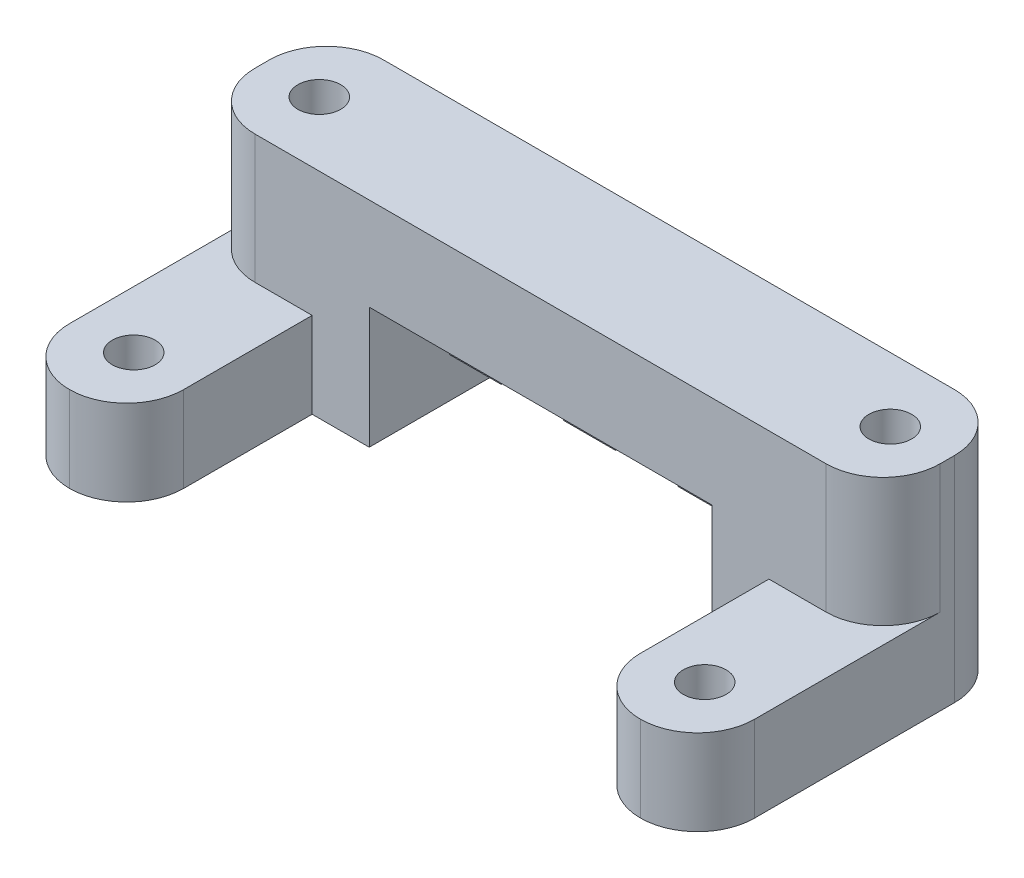
from build123d import *

# Parameters (mm, degrees)
BOSS_EXTRUDE1_DEPTH           = 9
SKETCH2_W                     = 4
SKETCH2_H                     = 2.5
BOSS_EXTRUDE2_DEPTH           = 3.5
BOSS_EXTRUDE2_DRAFT           = 3
BOSS_EXTRUDE2_PROFILE_2_DEPTH = 3.5
BOSS_EXTRUDE2_PROFILE_2_DRAFT = 3
BOSS_EXTRUDE2_PROFILE_3_DEPTH = 3.5
BOSS_EXTRUDE2_PROFILE_3_DRAFT = 3
SKETCH4_W                     = 8
SKETCH4_H                     = 6
BOSS_EXTRUDE4_DEPTH           = 13
SKETCH3_R                     = 1.5
CUT_EXTRUDE1_DEPTH            = 55.890800686
FILLET1_R                     = 4


with BuildPart() as part:
    # Sketch1 → Boss-Extrude1 (new body)
    with BuildSketch(Plane.XY):
        Polygon((0, 0), (12, 0), (12, 8.5), (36, 8.5), (36, 0), (48, 0), (48, 15), (0, 15), align=None)
    extrude(amount=BOSS_EXTRUDE1_DEPTH)


with BuildPart() as boss_extrude2_tool:
    # Sketch2 → Boss-Extrude2 (with draft: the straight prism first)
    with BuildSketch(Plane(origin=(0, 8.5, 0), x_dir=(-1, 0, 0), z_dir=(0, -1, 0))):
        with Locations((-16, -4.5)):
            Rectangle(SKETCH2_W, SKETCH2_H)
    extrude(amount=BOSS_EXTRUDE2_DEPTH)
    # Boss-Extrude2: the draft: its side faces are tilted about the plane it starts from
    boss_extrude2_sides = [boss_extrude2_tool.faces().sort_by_distance(p)[0] for p in [
        (14, 6.75, 4.5),
        (16, 6.75, 3.25),
        (18, 6.75, 4.5),
        (16, 6.75, 5.75),
    ]]
    draft(boss_extrude2_sides, Plane(origin=(0, 8.5, 0), x_dir=(-1, 0, 0), z_dir=(0, -1, 0)), BOSS_EXTRUDE2_DRAFT)


with BuildPart() as part_1:
    add(part.part)

    # Boss-Extrude2: add boss_extrude2_tool
    add(boss_extrude2_tool.part)


with BuildPart() as boss_extrude2_profile_2_tool:
    # Sketch2 → Boss-Extrude2 profile 2 (with draft: the straight prism first)
    with BuildSketch(Plane(origin=(0, 8.5, 0), x_dir=(-1, 0, 0), z_dir=(0, -1, 0))):
        with Locations((-24, -4.5)):
            Rectangle(SKETCH2_W, SKETCH2_H)
    extrude(amount=BOSS_EXTRUDE2_PROFILE_2_DEPTH)
    # Boss-Extrude2 profile 2: the draft: its side faces are tilted about the plane it starts from
    boss_extrude2_profile_2_sides = [boss_extrude2_profile_2_tool.faces().sort_by_distance(p)[0] for p in [
        (22, 6.75, 4.5),
        (24, 6.75, 3.25),
        (26, 6.75, 4.5),
        (24, 6.75, 5.75),
    ]]
    draft(boss_extrude2_profile_2_sides, Plane(origin=(0, 8.5, 0), x_dir=(-1, 0, 0), z_dir=(0, -1, 0)), BOSS_EXTRUDE2_PROFILE_2_DRAFT)


with BuildPart() as part_2:
    add(part_1.part)

    # Boss-Extrude2 profile 2: add boss_extrude2_profile_2_tool
    add(boss_extrude2_profile_2_tool.part)


with BuildPart() as boss_extrude2_profile_3_tool:
    # Sketch2 → Boss-Extrude2 profile 3 (with draft: the straight prism first)
    with BuildSketch(Plane(origin=(0, 8.5, 0), x_dir=(-1, 0, 0), z_dir=(0, -1, 0))):
        with Locations((-32, -4.5)):
            Rectangle(SKETCH2_W, SKETCH2_H)
    extrude(amount=BOSS_EXTRUDE2_PROFILE_3_DEPTH)
    # Boss-Extrude2 profile 3: the draft: its side faces are tilted about the plane it starts from
    boss_extrude2_profile_3_sides = [boss_extrude2_profile_3_tool.faces().sort_by_distance(p)[0] for p in [
        (30, 6.75, 4.5),
        (32, 6.75, 3.25),
        (34, 6.75, 4.5),
        (32, 6.75, 5.75),
    ]]
    draft(boss_extrude2_profile_3_sides, Plane(origin=(0, 8.5, 0), x_dir=(-1, 0, 0), z_dir=(0, -1, 0)), BOSS_EXTRUDE2_PROFILE_3_DRAFT)


with BuildPart() as part_3:
    add(part_2.part)

    # Boss-Extrude2 profile 3: add boss_extrude2_profile_3_tool
    add(boss_extrude2_profile_3_tool.part)

    # Sketch4 → Boss-Extrude4 (add)
    with BuildSketch(Plane.XY.offset(9)):
        with Locations((4, 3)):
            Rectangle(SKETCH4_W, SKETCH4_H)
        with Locations((44, 3)):
            Rectangle(SKETCH4_W, SKETCH4_H)
    extrude(amount=BOSS_EXTRUDE4_DEPTH)

    # Sketch3 → Cut-Extrude1 (cut, through all)
    with BuildSketch(Plane(origin=(0, 15, 0), x_dir=(1, 0, 0), z_dir=(0, 1, 0))):
        with Locations(Location((4, -4.5, 0), (0, 0, 270))):
            Circle(SKETCH3_R)
        with Locations(Location((44, -4.5, 0), (0, 0, 270))):
            Circle(SKETCH3_R)
        with Locations(Location((4, -17.5, 0), (0, 0, 270))):
            Circle(SKETCH3_R)
        with Locations(Location((44, -17.5, 0), (0, 0, 270))):
            Circle(SKETCH3_R)
    extrude(amount=-CUT_EXTRUDE1_DEPTH, mode=Mode.SUBTRACT)

    # Fillet1
    fillet1_edges = [part_3.edges().sort_by_distance(p)[0] for p in [
        (40, 3, 22),
        (48, 3, 22),
        (48, 7.5, 0),
        (48, 10.5, 9),
        (0, 3, 22),
        (8, 3, 22),
        (0, 7.5, 0),
        (0, 10.5, 9),
    ]]
    fillet(fillet1_edges, radius=FILLET1_R - 0.0001)  # a hair under: the kernel refuses the full size


solid = part_3.part
